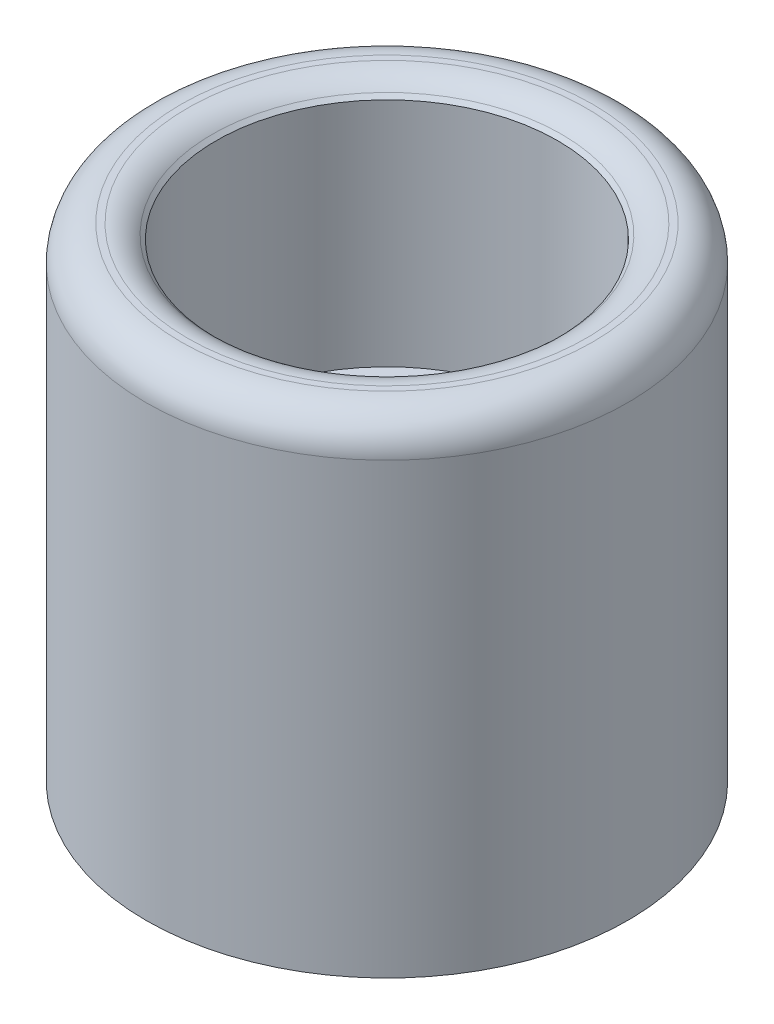
from build123d import *

# Parameters (mm, degrees)
SKETCH1_R              = 34.384
SKETCH1_R_2            = 24.384
BOSS_EXTRUDE1_DEPTH    = 35
BOSS_EXTRUDE2_START    = -34
SKETCH1_3_R            = 34.384
BOSS_EXTRUDE2_DEPTH    = 34
CHAMFER1_SIZE          = 2
FILLET2_R              = 5
CUT_EXTRUDE1_DEPTH     = 7.14375
F_10_0MM_DOWEL_HOLE1_D = 10


with BuildPart() as part:
    # Sketch1 → Boss-Extrude1 (new body)
    with BuildSketch(Plane(origin=(0, 0, 0), x_dir=(1, 0, 0), z_dir=(0, 1, 0))):
        Circle(SKETCH1_R)
        Circle(SKETCH1_R_2, mode=Mode.SUBTRACT)
    extrude(amount=BOSS_EXTRUDE1_DEPTH)

    # Sketch1<3> → Boss-Extrude2 (add)
    with BuildSketch(Plane(origin=(0, 0, 0), x_dir=(1, 0, 0), z_dir=(0, 1, 0)).offset(BOSS_EXTRUDE2_START)):
        Circle(SKETCH1_3_R)
    extrude(amount=BOSS_EXTRUDE2_DEPTH)

    # Chamfer1
    chamfer1_edges = [part.edges().sort_by_distance(p)[0] for p in [
        (-24.384, 35, 0),
    ]]
    chamfer(chamfer1_edges, length=CHAMFER1_SIZE)

    # Fillet2
    fillet2_edges = [part.edges().sort_by_distance(p)[0] for p in [
        (-34.384, 35, 0),
        (-26.384, 35, 0),
    ]]
    fillet(fillet2_edges, radius=FILLET2_R)

    # Sketch10 → Cut-Extrude1 (cut)
    with BuildSketch(Plane(origin=(0, -19, 0), x_dir=(-1, 0, 0), z_dir=(0, -1, 0))):
        Polygon((7.794228634, 0), (3.897114317, 6.75), (-3.897114317, 6.75), (-7.794228634, 0), (-3.897114317, -6.75), (3.897114317, -6.75), align=None)
    extrude(amount=CUT_EXTRUDE1_DEPTH, mode=Mode.SUBTRACT)

    # Ø10.0mm Dowel Hole1 (through all)
    with Locations(Plane(origin=(0, -34, 0), x_dir=(-1, 0, 0), z_dir=(0, -1, 0))):
        with Locations((0, 0)):
            Hole(F_10_0MM_DOWEL_HOLE1_D / 2)


solid = part.part
